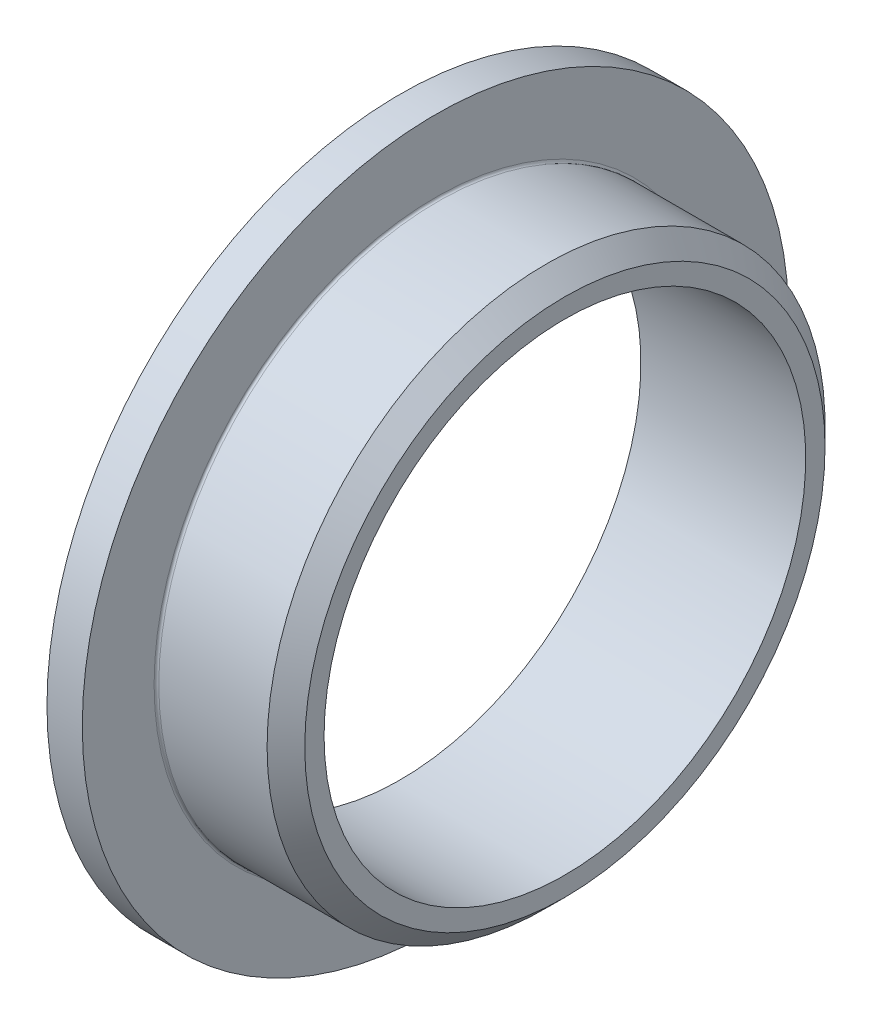
from build123d import *

# Parameters (mm, degrees)
FILLET1_R     = 0.1
CHAMFER1_SIZE = 0.8


with BuildPart() as part:
    # Sketch1 → Revolve1 (revolve)
    with BuildSketch(Plane.XY):
        Polygon((7, 10.23), (0, 10.23), (0, 15), (1.5, 15), (1.5, 11.85), (7, 11.85), align=None)
    revolve(axis=Axis((0, 0, 0), (1, 0, 0)))

    # Fillet1
    fillet1_edges = [part.edges().sort_by_distance(p)[0] for p in [
        (1.5, -11.85, 0),
    ]]
    fillet(fillet1_edges, radius=FILLET1_R)

    # Chamfer1
    chamfer1_edges = [part.edges().sort_by_distance(p)[0] for p in [
        (7, -11.85, 0),
    ]]
    chamfer(chamfer1_edges, length=CHAMFER1_SIZE)


solid = part.part
